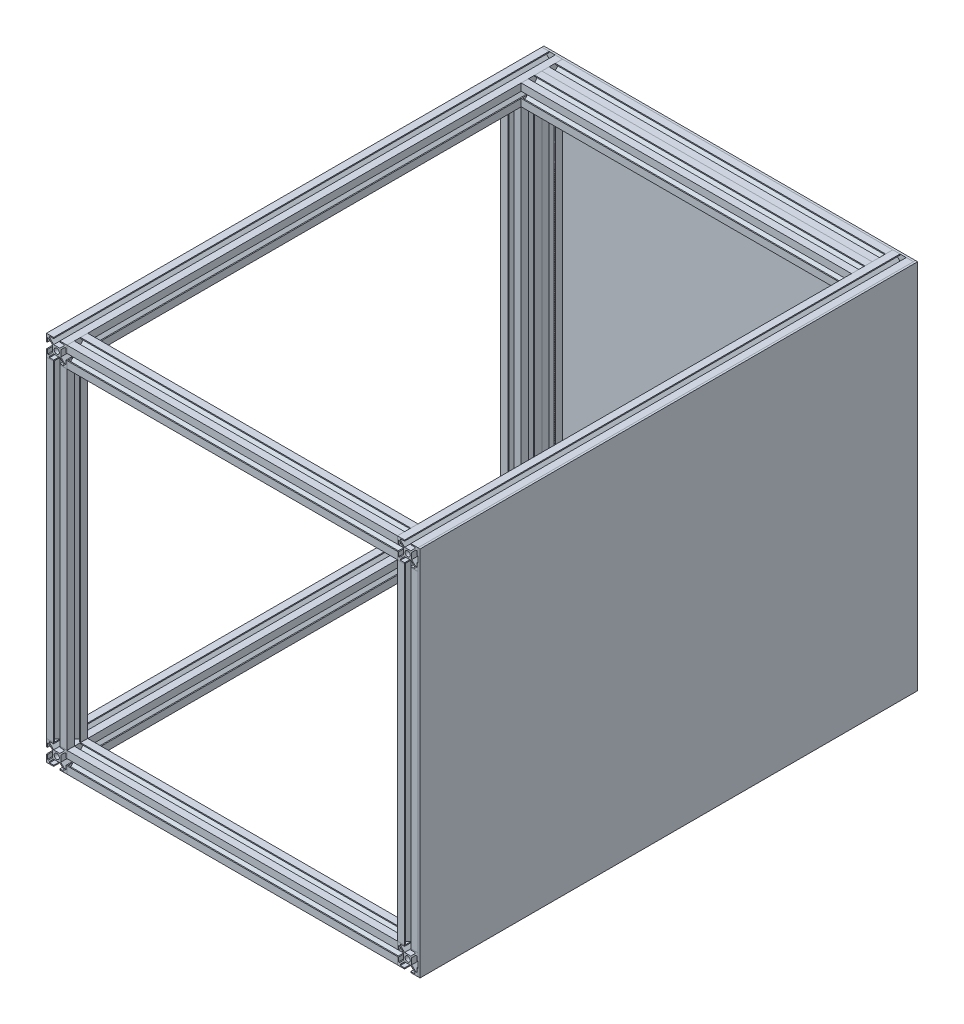
from build123d import *

# Parameters (mm, degrees)
SKETCH2_R                        = 2.5
CIRPATTERN1_COUNT                = 4
SKETCH4_R                        = 2.5
ALUMINIUM_EXTRUSION_PILLAR_DEPTH = 480
CIRPATTERN2_COUNT                = 4
SKETCH5_W                        = 360
SKETCH5_H                        = 360
SKETCH5_R                        = 2.5
BOTTOM_PLATE_DEPTH               = 2
SKETCH6_W                        = 360
SKETCH6_H                        = 482
BACK_PLATE_DEPTH                 = 2


with BuildPart() as part:
    # Aluminium Extrsion Base: sweep along a path in Sketch1
    with BuildLine(Plane(origin=(0, 0, 0), x_dir=(0, 1, 0), z_dir=(0, 0, 1))) as aluminium_extrsion_base_path:
        Line((-160, 160), (-160, -160))
    # Sketch2 → Aluminium Extrsion Base (sweep)
    with BuildSketch(Plane.YZ):
        Polygon((-180, 3), (-180, 10), (-173, 10), (-173, 9), (-177, 9), (-177, 7.985679549), (-173, 3.985679549), (-170, 3.985679549), (-167, 3.985679549), (-163, 7.985679549), (-163, 9), (-167, 9), (-167, 10), (-160, 10), (-160, 3), (-161, 3), (-161, 7), (-162.014320451, 7), (-166.014320451, 3), (-166.014320451, 0), (-166.014320451, -3), (-162.014320451, -7), (-161, -7), (-161, -3), (-160, -3), (-160, -10), (-167, -10), (-167, -9), (-163, -9), (-163, -7.985679549), (-167, -3.985679549), (-170, -3.985679549), (-173, -3.985679549), (-177, -7.985679549), (-177, -9), (-173, -9), (-173, -10), (-180, -10), (-180, -3), (-179, -3), (-179, -7), (-177.985679549, -7), (-173.985679549, -3), (-173.985679549, 0), (-173.985679549, 3), (-177.985679549, 7), (-179, 7), (-179, 3), align=None)
        with Locations((-170, 0)):
            Circle(SKETCH2_R, mode=Mode.SUBTRACT)
    sweep(path=aluminium_extrsion_base_path.line)


with BuildPart() as cirpattern1_1:
    # CirPattern1: pattern copy
    add(part.part.rotate(Axis((0, 0, 0), (0, 0, 1)), 1 * 360 / CIRPATTERN1_COUNT))


with BuildPart() as cirpattern1_2:
    # CirPattern1: pattern copy
    add(part.part.rotate(Axis((0, 0, 0), (0, 0, 1)), 2 * 360 / CIRPATTERN1_COUNT))


with BuildPart() as cirpattern1_3:
    # CirPattern1: pattern copy
    add(part.part.rotate(Axis((0, 0, 0), (0, 0, 1)), 3 * 360 / CIRPATTERN1_COUNT))


with BuildPart() as body_5:
    # Mirror5: mirrored copy
    add(cirpattern1_1.part.mirror(Plane(origin=(-160, 167, 10), x_dir=(1, 0, 0), z_dir=(0, 0, -1))))


with BuildPart() as body_6:
    # Mirror5 2: mirrored copy
    add(part.part.mirror(Plane(origin=(-160, 167, 10), x_dir=(1, 0, 0), z_dir=(0, 0, -1))))


with BuildPart() as body_7:
    # Mirror5 3: mirrored copy
    add(cirpattern1_3.part.mirror(Plane(origin=(-160, 167, 10), x_dir=(1, 0, 0), z_dir=(0, 0, -1))))


with BuildPart() as body_8:
    # Mirror5 4: mirrored copy
    add(cirpattern1_2.part.mirror(Plane(origin=(-160, 167, 10), x_dir=(1, 0, 0), z_dir=(0, 0, -1))))


with BuildPart() as body_9:
    # Sketch4 → Aluminium Extrusion Pillar (new body)
    with BuildSketch(Plane(origin=(0, 0, -10), x_dir=(0, 1, 0), z_dir=(0, 0, 1))):
        Polygon((-180, -167), (-180, -160), (-173, -160), (-173, -161), (-177, -161), (-177, -162.089574502), (-173, -166.089574502), (-170, -166.089574502), (-167, -166.089574502), (-163, -162.089574502), (-163, -161), (-167, -161), (-167, -160), (-160, -160), (-160, -167), (-161, -167), (-161, -163), (-162.089574502, -163), (-166.089574502, -167), (-166.089574502, -170), (-166.089574502, -173), (-162.089574502, -177), (-161, -177), (-161, -173), (-160, -173), (-160, -180), (-167, -180), (-167, -179), (-163, -179), (-163, -177.910425498), (-167, -173.910425498), (-170, -173.910425498), (-173, -173.910425498), (-177, -177.910425498), (-177, -179), (-173, -179), (-173, -180), (-180, -180), (-180, -173), (-179, -173), (-179, -177), (-177.910425498, -177), (-173.910425498, -173), (-173.910425498, -170), (-173.910425498, -167), (-177.910425498, -163), (-179, -163), (-179, -167), align=None)
        with Locations((-170, -170)):
            Circle(SKETCH4_R, mode=Mode.SUBTRACT)
    extrude(amount=ALUMINIUM_EXTRUSION_PILLAR_DEPTH)


with BuildPart() as cirpattern2_1:
    # CirPattern2: pattern copy
    add(body_9.part.rotate(Axis((0, 0, 0), (0, 0, 1)), 1 * 360 / CIRPATTERN2_COUNT))


with BuildPart() as cirpattern2_2:
    # CirPattern2: pattern copy
    add(body_9.part.rotate(Axis((0, 0, 0), (0, 0, 1)), 2 * 360 / CIRPATTERN2_COUNT))


with BuildPart() as cirpattern2_3:
    # CirPattern2: pattern copy
    add(body_9.part.rotate(Axis((0, 0, 0), (0, 0, 1)), 3 * 360 / CIRPATTERN2_COUNT))


with BuildPart() as body_13:
    # Mirror4: mirrored copy
    add(cirpattern1_3.part.mirror(Plane.XY.offset(230)))


with BuildPart() as body_14:
    # Mirror4 2: mirrored copy
    add(part.part.mirror(Plane.XY.offset(230)))


with BuildPart() as body_15:
    # Mirror4 3: mirrored copy
    add(cirpattern1_1.part.mirror(Plane.XY.offset(230)))


with BuildPart() as body_16:
    # Mirror4 4: mirrored copy
    add(cirpattern1_2.part.mirror(Plane.XY.offset(230)))


with BuildPart() as body_17:
    # Sketch5 → Bottom Plate (new body)
    with BuildSketch(Plane(origin=(0, 0, -10), x_dir=(1, 0, 0), z_dir=(0, 0, -1))):
        Rectangle(SKETCH5_W, SKETCH5_H)
        with Locations((-170, -170)):
            Circle(SKETCH5_R, mode=Mode.SUBTRACT)
        with Locations((170, -170)):
            Circle(SKETCH5_R, mode=Mode.SUBTRACT)
        with Locations((170, 170)):
            Circle(SKETCH5_R, mode=Mode.SUBTRACT)
        with Locations((-170, 170)):
            Circle(SKETCH5_R, mode=Mode.SUBTRACT)
    extrude(amount=BOTTOM_PLATE_DEPTH)


with BuildPart() as body_18:
    # Sketch6 → Back Plate (new body)
    with BuildSketch(Plane.YZ.offset(180)):
        with Locations((0, 229)):
            Rectangle(SKETCH6_W, SKETCH6_H)
    extrude(amount=BACK_PLATE_DEPTH)


solid = Compound([part.part, cirpattern1_1.part, cirpattern1_2.part, cirpattern1_3.part, body_5.part, body_6.part, body_7.part, body_8.part, body_9.part, cirpattern2_1.part, cirpattern2_2.part, cirpattern2_3.part, body_13.part, body_14.part, body_15.part, body_16.part, body_17.part, body_18.part])
